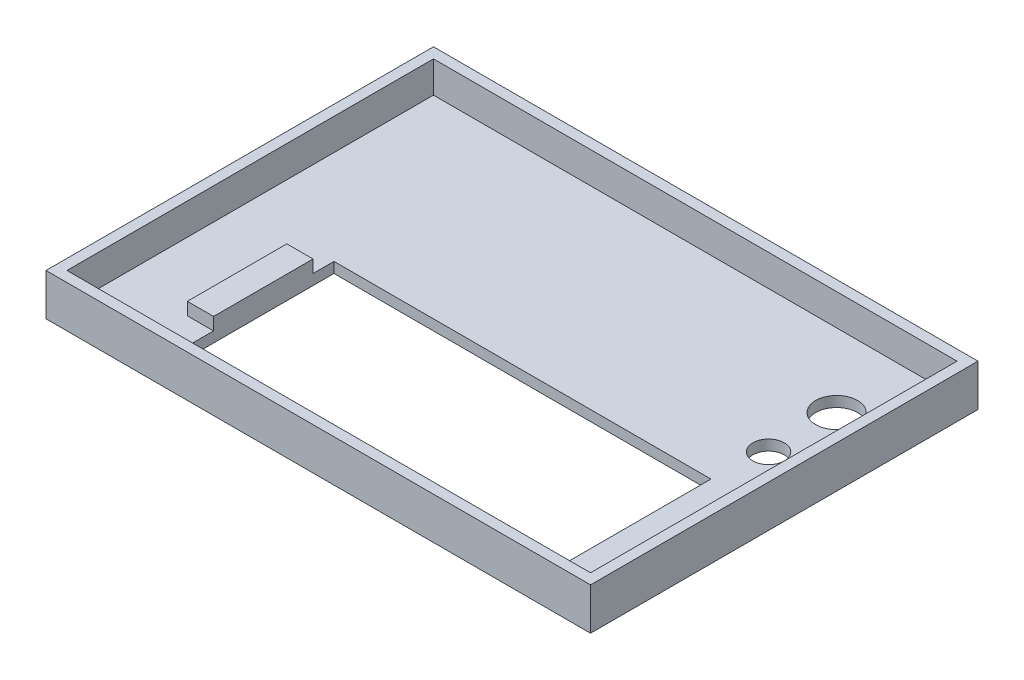
from build123d import *

# Parameters (mm, degrees)
SKETCH1_W           = 104
SKETCH1_H           = 74
BOSS_EXTRUDE1_DEPTH = 8
SKETCH2_W           = 100
SKETCH2_H           = 70
CUT_EXTRUDE1_DEPTH  = 6
SKETCH5_W           = 2
SKETCH5_H           = 70
EXTRUDE_THIN2_DEPTH = 6
SKETCH6_W           = 2
SKETCH6_H           = 70
EXTRUDE_THIN4_DEPTH = 6
SKETCH7_R           = 4
CUT_EXTRUDE3_DEPTH  = 2
SKETCH9_W           = 72
SKETCH9_H           = 28
CUT_EXTRUDE4_DEPTH  = 2
SKETCH10_R          = 3
CUT_EXTRUDE5_DEPTH  = 2
BOSS_EXTRUDE2_DEPTH = 1
SKETCH12_W          = 5
SKETCH12_H          = 19
BOSS_EXTRUDE3_DEPTH = 2.4


with BuildPart() as part:
    # Sketch1 → Boss-Extrude1 (new body)
    with BuildSketch(Plane(origin=(0, 0, 0), x_dir=(1, 0, 0), z_dir=(0, 1, 0))):
        Rectangle(SKETCH1_W, SKETCH1_H)
    extrude(amount=BOSS_EXTRUDE1_DEPTH)

    # Sketch2 → Cut-Extrude1 (cut)
    with BuildSketch(Plane(origin=(0, 8, 0), x_dir=(1, 0, 0), z_dir=(0, 1, 0))):
        Rectangle(SKETCH2_W, SKETCH2_H)
    extrude(amount=-CUT_EXTRUDE1_DEPTH, mode=Mode.SUBTRACT)

    # Sketch5 → Extrude-Thin2 (add)
    with BuildSketch(Plane(origin=(0, 2, 0), x_dir=(1, 0, 0), z_dir=(0, 1, 0))):
        with Locations((-51, 0)):
            Rectangle(SKETCH5_W, SKETCH5_H)
    extrude(amount=EXTRUDE_THIN2_DEPTH)

    # Sketch6 → Extrude-Thin4 (add)
    with BuildSketch(Plane(origin=(0, 2, 0), x_dir=(1, 0, 0), z_dir=(0, 1, 0))):
        with Locations((51, 0)):
            Rectangle(SKETCH6_W, SKETCH6_H)
    extrude(amount=EXTRUDE_THIN4_DEPTH)

    # Sketch7 → Cut-Extrude3 (cut)
    with BuildSketch(Plane.XZ):
        with Locations((41, -21)):
            Circle(SKETCH7_R)
    extrude(amount=-CUT_EXTRUDE3_DEPTH, mode=Mode.SUBTRACT)

    # Sketch9 → Cut-Extrude4 (cut)
    with BuildSketch(Plane.XZ):
        with Locations((4, 16)):
            Rectangle(SKETCH9_W, SKETCH9_H)
    extrude(amount=-CUT_EXTRUDE4_DEPTH, mode=Mode.SUBTRACT)

    # Sketch10 → Cut-Extrude5 (cut)
    with BuildSketch(Plane.XZ):
        with Locations((41, -8)):
            Circle(SKETCH10_R)
    extrude(amount=-CUT_EXTRUDE5_DEPTH, mode=Mode.SUBTRACT)

    # Sketch11 → Boss-Extrude2 (add)
    with BuildSketch(Plane.XZ):
        Polygon((-6.77214012, -2.363483475), (-5.363785085, -2.363483475), (-2.186029009, -6.890338944), (-2.186029009, -2.363483475), (-0.774917897, -2.363483475), (-0.774917897, -9.242650142), (-2.194297238, -9.242650142), (-5.361029009, -4.729575055), (-5.361029009, -9.242650142), (-6.77214012, -9.242650142), align=None)
        Polygon((0.900776547, -2.363483475), (4.516748769, -2.363483475), (4.516748769, -3.598205698), (2.311887658, -3.598205698), (2.311887658, -4.921122364), (4.516748769, -4.921122364), (4.516748769, -6.155844586), (2.311887658, -6.155844586), (2.311887658, -9.242650142), (0.900776547, -9.242650142), align=None)
        with BuildLine():
            Line((12.542443214, -3.556864552), (11.576438439, -4.422272538))
            add(Edge.make_bspline(
                [(11.576438439, -4.422272538), (11.419045567, -4.26389275), (11.172370531, -4.043197377), (10.807949005, -3.811006026), (10.534922449, -3.666482773), (10.251808208, -3.558082118), (9.863969616, -3.451118042), (9.562136716, -3.42140955), (9.360553023, -3.421816809)],
                knots=[0, 0, 0, 0, 0.268395821, 0.394876435, 0.517931434, 0.638546247, 0.75798718, 1, 1, 1, 1], degree=3))
            add(Edge.make_bspline(
                [(9.360553023, -3.421816809), (9.19365115, -3.422710554), (8.945820236, -3.440982281), (8.627699148, -3.514547052), (8.401919241, -3.5883234), (8.187363848, -3.686133702), (7.982137195, -3.803089572), (7.788752943, -3.943838929), (7.606878799, -4.102308259), (7.440669068, -4.27620721), (7.295084021, -4.462399462), (7.173576845, -4.659894179), (7.071546765, -4.865508288), (6.994775518, -5.08279221), (6.917340801, -5.388623958), (6.898563358, -5.628301147), (6.897998769, -5.789286427)],
                knots=[0, 0, 0, 0, 0.131536642, 0.194623192, 0.256731629, 0.318247435, 0.379979787, 0.442420155, 0.506253001, 0.569700394, 0.631560829, 0.691985514, 0.751999593, 0.811950419, 0.873095054, 1, 1, 1, 1], degree=3))
            add(Edge.make_bspline(
                [(6.897998769, -5.789286427), (6.89973393, -5.902394257), (6.906329736, -6.070755092), (6.940223677, -6.290012119), (6.974645573, -6.44743283), (7.01847986, -6.600150043), (7.074609627, -6.747234171), (7.136986776, -6.891351318), (7.211899064, -7.028454757), (7.294536848, -7.15979272), (7.385727255, -7.284127231), (7.485242956, -7.401483324), (7.592559996, -7.512015384), (7.709077874, -7.61422097), (7.833231295, -7.709044899), (7.96488, -7.798088757), (8.104336475, -7.878823685), (8.250805619, -7.949859664), (8.400620568, -8.014133414), (8.555273144, -8.065959849), (8.713638715, -8.108761725), (8.875372752, -8.143799882), (9.099623958, -8.174163959), (9.270148509, -8.1861409), (9.38535771, -8.184316809)],
                knots=[0, 0, 0, 0, 0.087755687, 0.13025449, 0.171807667, 0.212595709, 0.253267038, 0.293755622, 0.334219152, 0.374224259, 0.413960707, 0.453622116, 0.493403201, 0.53326069, 0.573637975, 0.614421355, 0.656375289, 0.698412232, 0.740535032, 0.782644287, 0.824706855, 0.867652221, 0.910803718, 1, 1, 1, 1], degree=3))
            add(Edge.make_bspline(
                [(9.38535771, -8.184316809), (9.577799983, -8.183427486), (9.86355796, -8.159974552), (10.228337011, -8.068058966), (10.444111122, -7.989548328), (10.612608434, -7.910174105), (10.741157765, -7.838019309), (10.873975728, -7.756807799), (11.008955585, -7.664051482), (11.147401137, -7.560226593), (11.340070827, -7.402008121), (11.483462511, -7.274469127), (11.577816478, -7.18386108)],
                knots=[0, 0, 0, 0, 0.232995195, 0.344724584, 0.45425304, 0.510182646, 0.56987792, 0.632494248, 0.698463076, 0.767925039, 0.841782413, 1, 1, 1, 1], degree=3))
            Line((11.577816478, -7.18386108), (12.513504412, -8.105768632))
            add(Edge.make_bspline(
                [(12.513504412, -8.105768632), (12.384877358, -8.224367326), (12.19029984, -8.391863741), (11.924102645, -8.595875187), (11.732242385, -8.73191074), (11.543233166, -8.854083245), (11.355991124, -8.960342646), (11.172544379, -9.054364239), (10.989171987, -9.133906048), (10.804672193, -9.202001456), (10.615328165, -9.259383093), (10.420185335, -9.309962097), (10.217962434, -9.348836367), (10.009829827, -9.381171847), (9.719979729, -9.410137877), (9.499026429, -9.420040028), (9.349528717, -9.419039031)],
                knots=[0, 0, 0, 0, 0.149037585, 0.218534824, 0.28562877, 0.349342308, 0.410155363, 0.468953593, 0.524855135, 0.580316717, 0.636386451, 0.693328685, 0.751957411, 0.811724163, 0.872696884, 1, 1, 1, 1], degree=3))
            add(Edge.make_bspline(
                [(9.349528717, -9.419039031), (9.07859367, -9.417375718), (8.677945849, -9.390927403), (8.164022094, -9.282500399), (7.804917746, -9.170646683), (7.465434173, -9.026942196), (7.145296368, -8.85059399), (6.843654291, -8.643646557), (6.565215741, -8.405318244), (6.312265232, -8.143956455), (6.091228221, -7.860883776), (5.904910664, -7.559241743), (5.75045947, -7.240531543), (5.631575997, -6.903530607), (5.518134966, -6.422208778), (5.485873379, -6.046467768), (5.486887658, -5.792042503)],
                knots=[0, 0, 0, 0, 0.136847231, 0.201781168, 0.264697838, 0.32640638, 0.387523671, 0.448875343, 0.510713106, 0.572201742, 0.632167905, 0.691617311, 0.75082753, 0.810590765, 0.871605507, 1, 1, 1, 1], degree=3))
            add(Edge.make_bspline(
                [(5.486887658, -5.792042503), (5.488952117, -5.624627145), (5.499998225, -5.376058915), (5.553185052, -5.052361779), (5.606444404, -4.819737622), (5.675627547, -4.593462825), (5.761018684, -4.37542885), (5.860809574, -4.163736889), (5.97678506, -3.960682688), (6.105614961, -3.764721807), (6.250329243, -3.579449578), (6.40687422, -3.403183347), (6.577336282, -3.237015827), (6.76100983, -3.081511441), (6.957287548, -2.934807254), (7.167311, -2.798323493), (7.389293618, -2.672611995), (7.619924683, -2.558193141), (7.857085587, -2.459085005), (8.09869082, -2.374946102), (8.34422998, -2.30530176), (8.594534142, -2.253921798), (8.935039318, -2.200618371), (9.194973886, -2.18899778), (9.368821252, -2.187094586)],
                knots=[0, 0, 0, 0, 0.085046396, 0.125902153, 0.16633604, 0.206083299, 0.245868825, 0.285078502, 0.324751171, 0.364451229, 0.403994917, 0.443954232, 0.484014745, 0.524700542, 0.566010711, 0.608299289, 0.651731, 0.695415373, 0.738884608, 0.782089231, 0.825191843, 0.868307691, 0.911696835, 1, 1, 1, 1], degree=3))
            add(Edge.make_bspline(
                [(9.368821252, -2.187094586), (9.517926304, -2.186843391), (9.740978299, -2.198376533), (10.035895714, -2.234269842), (10.253536195, -2.275358085), (10.469700664, -2.32402831), (10.682941864, -2.387336571), (10.895700976, -2.457804101), (11.104353926, -2.542668494), (11.309444162, -2.635506109), (11.507396915, -2.739081287), (11.699012322, -2.85061807), (11.881659956, -2.973891351), (12.058753822, -3.104753549), (12.285442042, -3.292472303), (12.442599254, -3.44829238), (12.542443214, -3.556864552)],
                knots=[0, 0, 0, 0, 0.125737408, 0.18821759, 0.25046303, 0.312499469, 0.3750397, 0.438022508, 0.501486221, 0.564949934, 0.627862378, 0.689866134, 0.751875944, 0.813641933, 0.875558453, 1, 1, 1, 1], degree=3))
        make_face()
        with BuildLine():
            ThreePointArc((-1.512865612, -23.000026234), (-0.080156104, -20.248373754), (-1.508594288, -17.494501523))
            ThreePointArc((-1.508594288, -17.494501523), (-2.329034918, -17.637339346), (-2.186197096, -18.457779977))
            ThreePointArc((-2.186197096, -18.457779977), (-1.25788702, -20.247460041), (-2.188972934, -22.035697539))
            ThreePointArc((-2.188972934, -22.035697539), (-2.33308362, -22.855915547), (-1.512865612, -23.000026234))
        make_face()
        with BuildLine():
            ThreePointArc((0.040176055, -25.488984761), (2.851336137, -20.248173167), (0.044188051, -15.005211523))
            ThreePointArc((0.044188051, -15.005211523), (-0.884325948, -15.191627603), (-0.697909869, -16.120141601))
            ThreePointArc((-0.697909869, -16.120141601), (1.51201611, -20.247660628), (-0.70106831, -24.373487029))
            ThreePointArc((-0.70106831, -24.373487029), (-0.888194994, -25.301858078), (0.040176055, -25.488984761))
        make_face()
        with BuildLine():
            ThreePointArc((2.678943115, -27.567089685), (6.100184955, -20.209957836), (2.623837342, -12.87870337))
            ThreePointArc((2.623837342, -12.87870337), (1.64483439, -12.973383885), (1.739514906, -13.952386838))
            ThreePointArc((1.739514906, -13.952386838), (4.709215822, -20.215176273), (1.786589503, -26.500071694))
            ThreePointArc((1.786589503, -26.500071694), (1.699257314, -27.479757496), (2.678943115, -27.567089685))
        make_face()
    extrude(amount=BOSS_EXTRUDE2_DEPTH)

    # Sketch12 → Boss-Extrude3 (add)
    with BuildSketch(Plane(origin=(0, 2, 0), x_dir=(1, 0, 0), z_dir=(0, 1, 0))):
        with Locations((-34.5, -15.5)):
            Rectangle(SKETCH12_W, SKETCH12_H)
    extrude(amount=BOSS_EXTRUDE3_DEPTH)


solid = part.part
